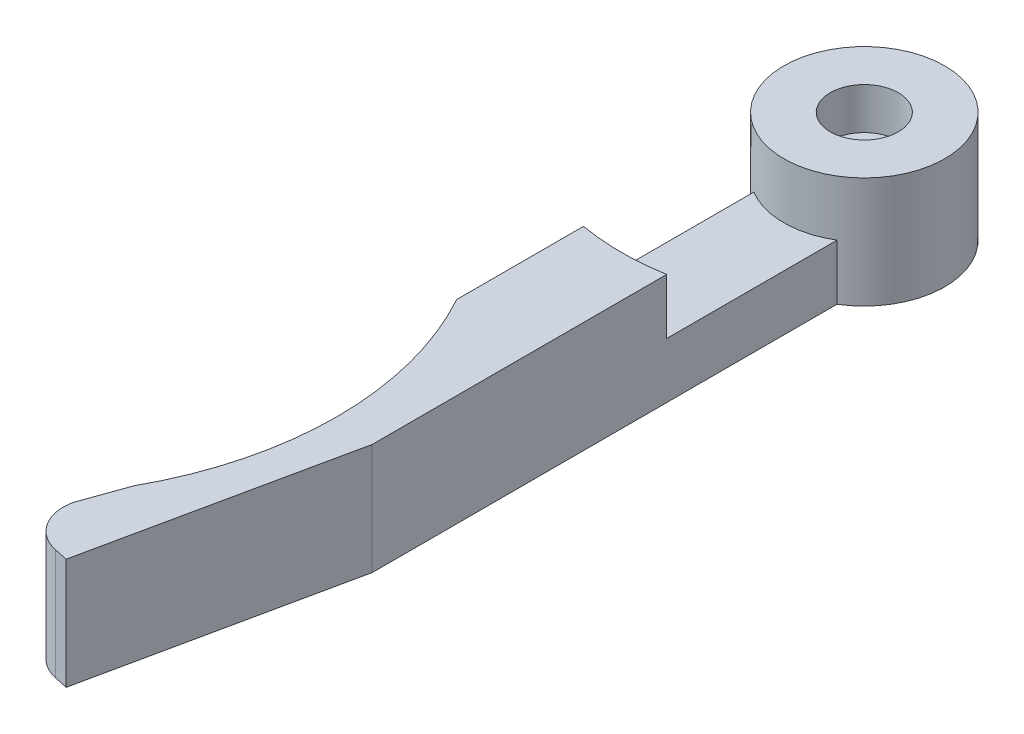
from build123d import *
from build123d.topology import SkipClean

# Parameters (mm, degrees)
BOSS_EXTRU_1_DEPTH             = 8
ESQUISSE2_R                    = 2.45
ENL_V_MAT_EXTRU_1_DEPTH        = 3
ENL_V_MAT_EXTRU_2_REACH        = 59.173
ESQUISSE3_R                    = 1.25
ESQUISSE4_R                    = 3
ENL_V_MAT_EXTRU_3_DEPTH        = 2
ENL_V_START                    = -4
ENL_V_MAT_EXTRU_4_DEPTH        = 4
CORPS_D_PLACER_COPIER1_DEPTH   = 8
CORPS_D_PLACER_COPIER1_2_DEPTH = 8
CORPS_D_PLACER_COPIER1_3_DEPTH = 4


# Read off the part's stored shape, not the designer's step: Corps-Déplacer/Copier1
with BuildPart() as part:
    # Esquisse1 → Boss.-Extru.1 (new body)
    with BuildSketch(Plane(origin=(0, 0, 0), x_dir=(1, 0, 0), z_dir=(0, 1, 0))):
        with BuildLine():
            Line((-3, 26.381049961), (-3, 4.963869458))
            ThreePointArc((-3, 4.963869458), (0, -5.8), (3, 4.963869458))
            Line((3, 4.963869458), (3, 38.463869458))
            Line((3, 38.463869458), (-0.867157449, 56.657414832))
            Line((-0.867157449, 56.657414832), (-1.84530505, 56.449503141))
            ThreePointArc((-1.84530505, 56.449503141), (-3.756758837, 55.119060789), (-4.140414176, 52.821988519))
            Line((-4.140414176, 52.821988519), (-3, 49.618950039))
            ThreePointArc((-3, 49.618950039), (0, 38), (-3, 26.381049961))
        make_face()
    extrude(amount=BOSS_EXTRU_1_DEPTH)

    # Esquisse2 → Enlèv. mat.-Extru.1 (cut)
    with BuildSketch(Plane(origin=(0, 8, 0), x_dir=(1, 0, 0), z_dir=(0, 1, 0))):
        with Locations(Location((0, 0, 0), (0, 0, 270))):
            Circle(ESQUISSE2_R)
    extrude(amount=-ENL_V_MAT_EXTRU_1_DEPTH, mode=Mode.SUBTRACT)

    # Esquisse3 → Enlèv. mat.-Extru.2 (cut, up to next)
    with BuildSketch(Plane(origin=(0, 5, 0), x_dir=(1, 0, 0), z_dir=(0, 1, 0)), mode=Mode.PRIVATE) as enl_v_mat_extru_2_sk1:
        with Locations(Location((0, 0, 0), (0, 0, 270))):
            Circle(ESQUISSE3_R)
    enl_v_mat_extru_2_tool1 = extrude(enl_v_mat_extru_2_sk1.sketch, amount=-ENL_V_MAT_EXTRU_2_REACH, mode=Mode.PRIVATE) & part.part
    add(enl_v_mat_extru_2_tool1.solids().sort_by_distance((0, 5, 0))[0], mode=Mode.SUBTRACT)

    # Esquisse4 → Enlèv. mat.-Extru.3 (cut)
    with BuildSketch(Plane.XZ):
        with Locations(Location((0, 0, 0), (0, 0, 270))):
            Circle(ESQUISSE4_R)
    extrude(amount=-ENL_V_MAT_EXTRU_3_DEPTH, mode=Mode.SUBTRACT)

    # Esquisse5 → Enlèv. mat.-Extru.4 (cut)
    with BuildSketch(Plane(origin=(0, 8, 0), x_dir=(1, 0, 0), z_dir=(0, 1, 0)).offset(ENL_V_START)):
        with BuildLine():
            Line((-3, 4.963869458), (-3, 17.24093965))
            ThreePointArc((-3, 17.24093965), (0, 17.5), (3, 17.24093965))
            Line((3, 17.24093965), (3, 4.963869458))
            ThreePointArc((3, 4.963869458), (0, 5.8), (-3, 4.963869458))
        make_face()
    extrude(amount=ENL_V_MAT_EXTRU_4_DEPTH, mode=Mode.SUBTRACT)

    # Corps-Déplacer/Copier1 outline → Corps-Déplacer/Copier1 (cut)
    with SkipClean():  # the faces are left unmerged after this step: merging them gives an invalid solid
        with BuildSketch(Plane(origin=(0, 0, 0), x_dir=(1, 0, 0), z_dir=(0, 1, 0))):
            with BuildLine():
                ThreePointArc((-3, 4.963869458), (0, 5.8), (3, 4.963869458))
                Line((3, 4.963869458), (3, 38.463869458))
                Line((3, 38.463869458), (-0.867157449, 56.657414832))
                Line((-0.867157449, 56.657414832), (-1.84530505, 56.449503141))
                ThreePointArc((-1.84530505, 56.449503141), (-3.756758837, 55.119060789), (-4.140414176, 52.821988519))
                Line((-4.140414176, 52.821988519), (-3, 49.618950039))
                ThreePointArc((-3, 49.618950039), (0, 38), (-3, 26.381049961))
                Line((-3, 26.381049961), (-3, 4.963869458))
            make_face()
        extrude(amount=CORPS_D_PLACER_COPIER1_DEPTH, mode=Mode.SUBTRACT)



with BuildPart() as body_2:
    # Corps-D_placer_Copier1 2 outline → Corps-D_placer_Copier1 2 (new body)
    with BuildSketch(Plane(origin=(0, 0, 0), x_dir=(1, 0, 0), z_dir=(0, 1, 0))):
        with BuildLine():
            Line((3, -38.463869458), (3, -17.24093965))
            ThreePointArc((3, -17.24093965), (0, -17.5), (-3, -17.24093965))
            Line((-3, -17.24093965), (-3, -26.381049961))
            ThreePointArc((-3, -26.381049961), (0, -38), (-3, -49.618950039))
            Line((-3, -49.618950039), (-4.140414176, -52.821988519))
            ThreePointArc((-4.140414176, -52.821988519), (-3.756758837, -55.119060789), (-1.84530505, -56.449503141))
            Line((-1.84530505, -56.449503141), (-0.867157449, -56.657414832))
            Line((-0.867157449, -56.657414832), (3, -38.463869458))
        make_face()
    extrude(amount=CORPS_D_PLACER_COPIER1_2_DEPTH)


with BuildPart() as part_1:
    with SkipClean():  # the faces are left unmerged after this step: merging them gives an invalid solid
        add(part.part)

        add(body_2.part)  # Corps-D_placer_Copier1 3 merges body 2
        # Corps-D_placer_Copier1 3 outline → Corps-D_placer_Copier1 3 (add)
        with BuildSketch(Plane(origin=(0, 0, 0), x_dir=(1, 0, 0), z_dir=(0, 1, 0))):
            with BuildLine():
                Line((3, -17.24093965), (3, -4.963869458))
                ThreePointArc((3, -4.963869458), (0, -5.8), (-3, -4.963869458))
                Line((-3, -4.963869458), (-3, -17.24093965))
                ThreePointArc((-3, -17.24093965), (0, -17.5), (3, -17.24093965))
            make_face()
        extrude(amount=CORPS_D_PLACER_COPIER1_3_DEPTH)


solid = part_1.part
